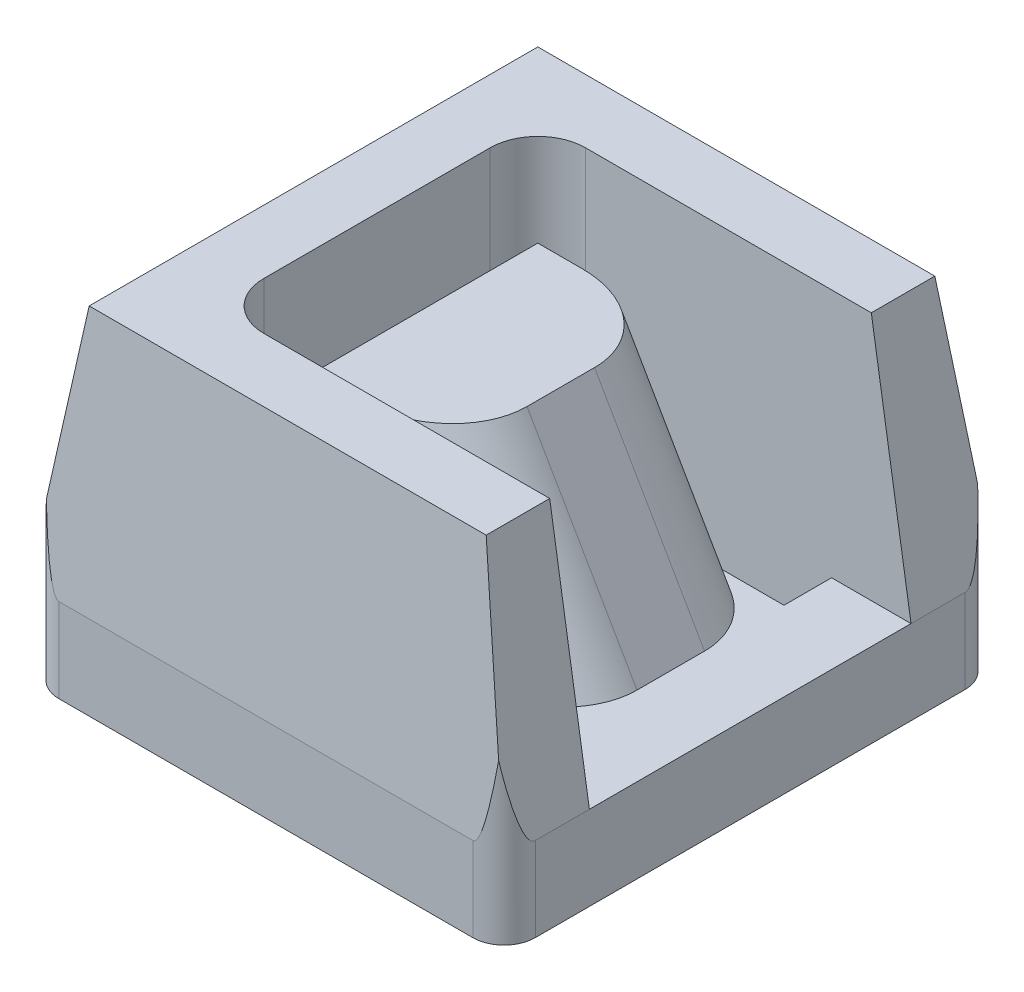
from build123d import *

# Parameters (mm, degrees)
EXTRUDE1_DEPTH      = 3.937
DRAFT1_START        = -3.81
DRAFT1_DEPTH        = 7.62
SKETCH3_W           = 5.969
SKETCH3_H           = 5.144225416
CUT_EXTRUDE1_DEPTH  = 16.999459798
CUT_EXTRUDE2_DEPTH  = 16.999459798
SKETCH5_W           = 3.937
SKETCH5_H           = 3.620225416
EXTRUDE2_DEPTH      = 3.048
DRAFT2_ANGLE        = 30
FILLET1_R           = 1.27
FILLET2_R           = 0.762
SKETCH6_W           = 3.937
SKETCH6_H           = 3.620225416
EXTRUDE3_DEPTH      = 1.3462
CUT_EXTRUDE3_DEPTH  = 16.999459798
SKETCH12_W          = 4.3942
SKETCH12_H          = 1.3462
BOSS_EXTRUDE1_DEPTH = 70
CUT_EXTRUDE8_DEPTH  = 1.524
LPATTERN1_START     = -1.524
LPATTERN1_DEPTH     = 3.048
CUT_EXTRUDE9_DEPTH  = 86.170550743
FILLET3_R           = 1
CUT_EXTRUDE10_DEPTH = 85.172743295
FILLET4_R           = 0.5
CUT_EXTRUDE11_START = -1.3462
CUT_EXTRUDE11_DEPTH = 1.3462


# Read off the part's stored shape, not the designer's step: Draft1, LPattern1, Cut-Extrude11
with BuildPart() as part:
    # Sketch1 → Extrude1 (new, symmetric)
    with BuildSketch(Plane.XY):
        Polygon((3.81, 1.3462), (3.175, 5.334), (-3.175, 5.334), (-3.81, 1.3462), (-3.81, 0), (14.986, 0), (14.986, 1.3462), align=None)
    extrude(amount=EXTRUDE1_DEPTH, both=True)

    # Draft1 outline → Draft1 (cut)
    with BuildSketch(Plane.YZ.offset(DRAFT1_START)):
        Polygon((1.3462, 3.937), (5.334, 3.588112708), (5.334, 3.937), align=None)
        Polygon((5.334, -3.588112708), (1.3462, -3.937), (5.334, -3.937), align=None)
    extrude(amount=DRAFT1_DEPTH, mode=Mode.SUBTRACT)

    # Sketch3 → Cut-Extrude1 (cut, through all)
    with BuildSketch(Plane(origin=(0, 1.3462, 0), x_dir=(-1, 0, 0), z_dir=(0, 1, 0))):
        with Locations((-0.8255, 0)):
            Rectangle(SKETCH3_W, SKETCH3_H)
    extrude(amount=CUT_EXTRUDE1_DEPTH, mode=Mode.SUBTRACT)

    # Sketch4 → Cut-Extrude2 (cut, through all)
    with BuildSketch(Plane(origin=(0, 1.3462, 0), x_dir=(-1, 0, 0), z_dir=(0, 1, 0))):
        Polygon((2.159, 2.572112708), (-2.54, 2.572112708), (-2.54, 1.810112708), (1.397, 1.810112708), (1.397, -1.810112708), (-2.54, -1.810112708), (-2.54, -2.572112708), (2.159, -2.572112708), align=None)
    extrude(amount=-CUT_EXTRUDE2_DEPTH, mode=Mode.SUBTRACT)

    # Sketch5 → Extrude2 (add)
    with BuildSketch(Plane(origin=(0, 1.3462, 0), x_dir=(-1, 0, 0), z_dir=(0, 1, 0))):
        with Locations((-0.5715, 0)):
            Rectangle(SKETCH5_W, SKETCH5_H)
    extrude(amount=EXTRUDE2_DEPTH)

    # Draft2
    draft2_faces = [part.faces().sort_by_distance(p)[0] for p in [
        (2.54, 2.8702, 0),
    ]]
    draft(draft2_faces, Plane(origin=(14.986, 1.3462, 3.937), x_dir=(1, 0, 0), z_dir=(0, 1, 0)), DRAFT2_ANGLE)

    # Fillet1
    # the kernel refuses this fillet: 1.27 mm, written as the material it takes off along each edge
    with BuildSketch(Plane(origin=(4.1275, -1.403430657, 1.810112708), x_dir=(-0.866025403784438, -0.500000000000001, 0), z_dir=(-0.500000000000001, 0.866025403784438, 0))) as fillet1_piece_1_section:
        with BuildLine():
            CenterArc((FILLET1_R, -FILLET1_R), FILLET1_R, 90, 90)
            Line((0, -FILLET1_R), (0, 0))
            Line((0, 0), (FILLET1_R, 0))
        make_face()
    fillet1_piece_1 = extrude(amount=9.869527241, mode=Mode.PRIVATE)
    fillet1_piece_1 = split(fillet1_piece_1, bisect_by=Plane(origin=(2.54, 0.912532514, 1.637821639), z_dir=(-1, 0, 0)), keep=Keep.TOP, mode=Mode.PRIVATE)
    add(fillet1_piece_1, mode=Mode.SUBTRACT)
    with BuildSketch(Plane(origin=(4.1275, -1.403430657, -1.810112708), x_dir=(-0.8660254037844382, -0.500000000000001, 0), z_dir=(-0.500000000000001, 0.866025403784438, 0))) as fillet1_piece_2_section:
        with BuildLine():
            CenterArc((FILLET1_R, FILLET1_R), FILLET1_R, 180, 90)
            Line((0, FILLET1_R), (0, 0))
            Line((0, 0), (FILLET1_R, 0))
        make_face()
    fillet1_piece_2 = extrude(amount=9.869527241, mode=Mode.PRIVATE)
    fillet1_piece_2 = split(fillet1_piece_2, bisect_by=Plane(origin=(2.54, 0.912532514, -1.637821639), z_dir=(-1, 0, 0)), keep=Keep.TOP, mode=Mode.PRIVATE)
    add(fillet1_piece_2, mode=Mode.SUBTRACT)

    # Fillet2
    fillet2_edges = [part.edges().sort_by_distance(p)[0] for p in [
        (-2.159, 2.667, 2.572112708),
        (-2.159, 2.667, -2.572112708),
    ]]
    fillet(fillet2_edges, radius=FILLET2_R)

    # Sketch6 → Extrude3 (add)
    with BuildSketch(Plane.XZ):
        with Locations((0.5715, 0)):
            Rectangle(SKETCH6_W, SKETCH6_H)
    extrude(amount=-EXTRUDE3_DEPTH)

    # Sketch7 → Cut-Extrude3 (cut, through all)
    with BuildSketch(Plane(origin=(0, 1.3462, 0), x_dir=(-1, 0, 0), z_dir=(0, 1, 0))):
        Polygon((-14.986, 3.937), (-3.81, 3.937), (-10.668, 2.1971), (-14.986, 2.1971), align=None)
        Polygon((-14.986, -3.937), (-3.81, -3.937), (-10.668, -2.1971), (-14.986, -2.1971), align=None)
    extrude(amount=-CUT_EXTRUDE3_DEPTH, mode=Mode.SUBTRACT)

    # Sketch12 → Boss-Extrude1 (add)
    with BuildSketch(Plane(origin=(14.986, 0, 0), x_dir=(0, 0, -1), z_dir=(1, 0, 0))):
        with Locations((0, 0.6731)):
            Rectangle(SKETCH12_W, SKETCH12_H)
    extrude(amount=BOSS_EXTRUDE1_DEPTH)

    # Sketch11 → Cut-Extrude8 (cut, symmetric)
    with BuildSketch(Plane.XY):
        Polygon((10.668, 1.3462), (10.668, 1.0922), (11.684, 1.3462), (11.684, 1.637608524), (10.668, 1.637608524), align=None)
    extrude(amount=CUT_EXTRUDE8_DEPTH, both=True, mode=Mode.SUBTRACT)

    # LPattern1 outline → LPattern1 (cut)
    with BuildSketch(Plane.XY.offset(LPATTERN1_START)):
        Polygon((14.184, 1.3462), (13.168, 1.3462), (13.168, 1.0922), align=None)
        Polygon((79.184, 1.3462), (78.168, 1.3462), (78.168, 1.0922), align=None)
        Polygon((76.684, 1.3462), (75.668, 1.3462), (75.668, 1.0922), align=None)
        Polygon((74.184, 1.3462), (73.168, 1.3462), (73.168, 1.0922), align=None)
        Polygon((71.684, 1.3462), (70.668, 1.3462), (70.668, 1.0922), align=None)
        Polygon((69.184, 1.3462), (68.168, 1.3462), (68.168, 1.0922), align=None)
        Polygon((66.684, 1.3462), (65.668, 1.3462), (65.668, 1.0922), align=None)
        Polygon((64.184, 1.3462), (63.168, 1.3462), (63.168, 1.0922), align=None)
        Polygon((61.684, 1.3462), (60.668, 1.3462), (60.668, 1.0922), align=None)
        Polygon((59.184, 1.3462), (58.168, 1.3462), (58.168, 1.0922), align=None)
        Polygon((56.684, 1.3462), (55.668, 1.3462), (55.668, 1.0922), align=None)
        Polygon((54.184, 1.3462), (53.168, 1.3462), (53.168, 1.0922), align=None)
        Polygon((51.684, 1.3462), (50.668, 1.3462), (50.668, 1.0922), align=None)
        Polygon((49.184, 1.3462), (48.168, 1.3462), (48.168, 1.0922), align=None)
        Polygon((46.684, 1.3462), (45.668, 1.3462), (45.668, 1.0922), align=None)
        Polygon((44.184, 1.3462), (43.168, 1.3462), (43.168, 1.0922), align=None)
        Polygon((41.684, 1.3462), (40.668, 1.3462), (40.668, 1.0922), align=None)
        Polygon((39.184, 1.3462), (38.168, 1.3462), (38.168, 1.0922), align=None)
        Polygon((36.684, 1.3462), (35.668, 1.3462), (35.668, 1.0922), align=None)
        Polygon((34.184, 1.3462), (33.168, 1.3462), (33.168, 1.0922), align=None)
        Polygon((31.684, 1.3462), (30.668, 1.3462), (30.668, 1.0922), align=None)
        Polygon((29.184, 1.3462), (28.168, 1.3462), (28.168, 1.0922), align=None)
        Polygon((26.684, 1.3462), (25.668, 1.3462), (25.668, 1.0922), align=None)
        Polygon((24.184, 1.3462), (23.168, 1.3462), (23.168, 1.0922), align=None)
        Polygon((21.684, 1.3462), (20.668, 1.3462), (20.668, 1.0922), align=None)
        Polygon((19.184, 1.3462), (18.168, 1.3462), (18.168, 1.0922), align=None)
        Polygon((16.684, 1.3462), (15.668, 1.3462), (15.668, 1.0922), align=None)
    extrude(amount=LPATTERN1_DEPTH, mode=Mode.SUBTRACT)

    # Sketch13 → Cut-Extrude9 (cut, through all)
    with BuildSketch(Plane(origin=(0, 1.3462, 0), x_dir=(1, 0, 0), z_dir=(0, 1, 0))):
        Polygon((84.986, -2.1971), (84.986, 0), (81.180511171, -2.1971), align=None)
        Polygon((81.180511171, 2.1971), (84.986, 0), (84.986, 2.1971), align=None)
    extrude(amount=-CUT_EXTRUDE9_DEPTH, mode=Mode.SUBTRACT)

    # Fillet3
    fillet3_edges = [part.edges().sort_by_distance(p)[0] for p in [
        (84.986, 0.6731, 0),
    ]]
    fillet(fillet3_edges, radius=FILLET3_R)

    # Sketch14 → Cut-Extrude10 (cut, through all)
    with BuildSketch(Plane(origin=(0, 1.3462, 0), x_dir=(1, 0, 0), z_dir=(0, 1, 0))):
        Polygon((10.668, 2.1971), (3.81, 2.1971), (3.81, 3.937), align=None)
    cut_extrude10 = extrude(amount=-CUT_EXTRUDE10_DEPTH, mode=Mode.SUBTRACT)

    # Mirror1: Cut-Extrude10 across plane
    add(cut_extrude10.mirror(Plane.XY), mode=Mode.SUBTRACT)

    # Fillet4
    # the kernel refuses this fillet: 0.5 mm, written as the material it adds along each edge
    with BuildSketch(Plane(origin=(3.81, 1.3462, -2.1971), x_dir=(1, 0, 0), z_dir=(0, -1, 0)), Plane(origin=(3.81, 1.3462, 2.1971), x_dir=(0, 0, 1), z_dir=(0, -1, 0))) as fillet4_piece_1:
        with BuildLine():
            CenterArc((FILLET4_R, -FILLET4_R), FILLET4_R, 90, 90)
            Line((0, -FILLET4_R), (0, 0))
            Line((0, 0), (FILLET4_R, 0))
        make_face()
    extrude(amount=1.3462)
    # the kernel refuses this fillet: 0.5 mm, written as the material it takes off along each edge
    with BuildSketch(Plane(origin=(3.81, 2.5962, 3.937), x_dir=(0, 0, -1), z_dir=(0, -1, 0)), Plane(origin=(-3.81, 2.5962, 3.937), x_dir=(1, 0, 0), z_dir=(0, -1, 0)), Plane(origin=(3.81, 2.5962, -3.937), x_dir=(-1, 0, 0), z_dir=(0, -1, 0)), Plane(origin=(-3.81, 2.5962, -3.937), x_dir=(0, 0, 1), z_dir=(0, -1, 0))) as fillet4_2_piece_1:
        with BuildLine():
            CenterArc((FILLET4_R, -FILLET4_R), FILLET4_R, 90, 90)
            Line((0, -FILLET4_R), (0, 0))
            Line((0, 0), (FILLET4_R, 0))
        make_face()
    extrude(amount=3.8462, mode=Mode.SUBTRACT)

    # Cut-Extrude11 outline → Cut-Extrude11 (cut)
    with BuildSketch(Plane(origin=(0, 1.3462, 0), x_dir=(1, 0, 0), z_dir=(0, 1, 0)).offset(CUT_EXTRUDE11_START)):
        with BuildLine():
            ThreePointArc((4.31, 2.1971), (3.956446609, 2.343546609), (3.81, 2.6971))
            Line((3.81, 2.6971), (3.81, -2.6971))
            ThreePointArc((3.81, -2.6971), (3.956446609, -2.343546609), (4.31, -2.1971))
            Line((4.31, -2.1971), (81.180511171, -2.1971))
            Line((81.180511171, -2.1971), (83.486, -0.866025404))
            ThreePointArc((83.486, -0.866025404), (83.986, 0), (83.486, 0.866025404))
            Line((83.486, 0.866025404), (81.180511171, 2.1971))
            Line((81.180511171, 2.1971), (4.31, 2.1971))
        make_face()
    extrude(amount=CUT_EXTRUDE11_DEPTH, mode=Mode.SUBTRACT)


solid = part.part
